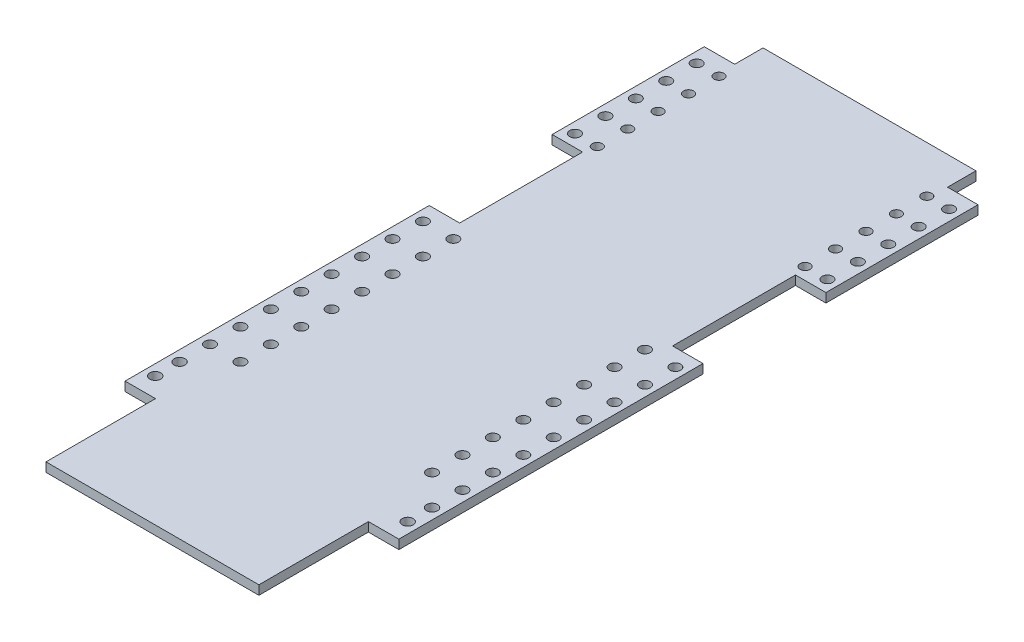
from build123d import *

# Parameters (mm, degrees)
BOSS_EXTRUDE5_DEPTH  = 3
M3_CLEARANCE_HOLE1_D = 3.6
SKETCH8_R            = 1.75
CUT_EXTRUDE1_DEPTH   = 249.962542564
SKETCH10_W           = 10
SKETCH10_H           = 50
SKETCH10_R           = 1.75
BOSS_EXTRUDE6_DEPTH  = 3
SKETCH11_R           = 1.65
CUT_EXTRUDE2_DEPTH   = 249.962542564


with BuildPart() as part:
    # Sketch5 → Boss-Extrude5 (new body)
    with BuildSketch(Plane(origin=(0, 0, 0), x_dir=(1, 0, 0), z_dir=(0, 1, 0))):
        Polygon((80, 136), (70, 136), (70, 235.74), (0, 235.74), (0, 136), (-10, 136), (-10, 36), (0, 36), (0, 0), (70, 0), (70, 36), (80, 36), align=None)
    extrude(amount=BOSS_EXTRUDE5_DEPTH)

    # M3 Clearance Hole1 (through all)
    with Locations(Plane(origin=(0, 3, 0), x_dir=(1, 0, 0), z_dir=(0, 1, 0))):
        with Locations((76.5, 50.420635549), (76.5, 42.420635549)):
            m3_clearance_hole1 = Hole(M3_CLEARANCE_HOLE1_D / 2)

    # Sketch8 → Cut-Extrude1 (cut, through all)
    with BuildSketch(Plane(origin=(0, 3, 0), x_dir=(1, 0, 0), z_dir=(0, 1, 0))):
        with Locations((76.5, 60.420635549)):
            Circle(SKETCH8_R)
        with Locations((66.5, 60.420635549)):
            Circle(SKETCH8_R)
        with Locations((66.5, 70.420635549)):
            Circle(SKETCH8_R)
        with Locations((66.5, 80.420635549)):
            Circle(SKETCH8_R)
        with Locations((66.5, 90.420635549)):
            Circle(SKETCH8_R)
        with Locations((66.5, 100.420635549)):
            Circle(SKETCH8_R)
        with Locations((66.5, 110.420635549)):
            Circle(SKETCH8_R)
        with Locations((66.5, 120.420635549)):
            Circle(SKETCH8_R)
        with Locations((66.5, 130.420635549)):
            Circle(SKETCH8_R)
        with Locations((76.5, 70.420635549)):
            Circle(SKETCH8_R)
        with Locations((76.5, 80.420635549)):
            Circle(SKETCH8_R)
        with Locations((76.5, 90.420635549)):
            Circle(SKETCH8_R)
        with Locations((76.5, 100.420635549)):
            Circle(SKETCH8_R)
        with Locations((76.5, 110.420635549)):
            Circle(SKETCH8_R)
        with Locations((76.5, 120.420635549)):
            Circle(SKETCH8_R)
        with Locations((76.5, 130.420635549)):
            Circle(SKETCH8_R)
    cut_extrude1 = extrude(amount=-CUT_EXTRUDE1_DEPTH, mode=Mode.SUBTRACT)

    # Sketch10 → Boss-Extrude6 (add)
    with BuildSketch(Plane.XZ):
        with Locations((75, -201.420635549)):
            Rectangle(SKETCH10_W, SKETCH10_H)
        with Locations((76.5, -180.420635549)):
            Circle(SKETCH10_R, mode=Mode.SUBTRACT)
        with Locations((76.5, -190.420635549)):
            Circle(SKETCH10_R, mode=Mode.SUBTRACT)
        with Locations((76.5, -200.420635549)):
            Circle(SKETCH10_R, mode=Mode.SUBTRACT)
        with Locations((76.5, -210.420635549)):
            Circle(SKETCH10_R, mode=Mode.SUBTRACT)
        with Locations((76.5, -220.420635549)):
            Circle(SKETCH10_R, mode=Mode.SUBTRACT)
    boss_extrude6 = extrude(amount=-BOSS_EXTRUDE6_DEPTH)

    # Sketch11 → Cut-Extrude2 (cut, through all)
    with BuildSketch(Plane(origin=(0, 3, 0), x_dir=(1, 0, 0), z_dir=(0, 1, 0))):
        with Locations((69.165215785, 180.420635549)):
            Circle(SKETCH11_R)
        with Locations((69.165215785, 190.420635549)):
            Circle(SKETCH11_R)
        with Locations((69.165215785, 200.420635549)):
            Circle(SKETCH11_R)
        with Locations((69.165215785, 210.420635549)):
            Circle(SKETCH11_R)
        with Locations((69.165215785, 220.420635549)):
            Circle(SKETCH11_R)
    cut_extrude2 = extrude(amount=-CUT_EXTRUDE2_DEPTH, mode=Mode.SUBTRACT)

    # Mirror1: M3 Clearance Hole1, Cut-Extrude1, Boss-Extrude6, Cut-Extrude2 across plane
    add(m3_clearance_hole1.mirror(Plane.ZY.offset(-35)), mode=Mode.SUBTRACT)
    add(cut_extrude1.mirror(Plane.ZY.offset(-35)), mode=Mode.SUBTRACT)
    add(boss_extrude6.mirror(Plane.ZY.offset(-35)))
    add(cut_extrude2.mirror(Plane.ZY.offset(-35)), mode=Mode.SUBTRACT)


solid = part.part
